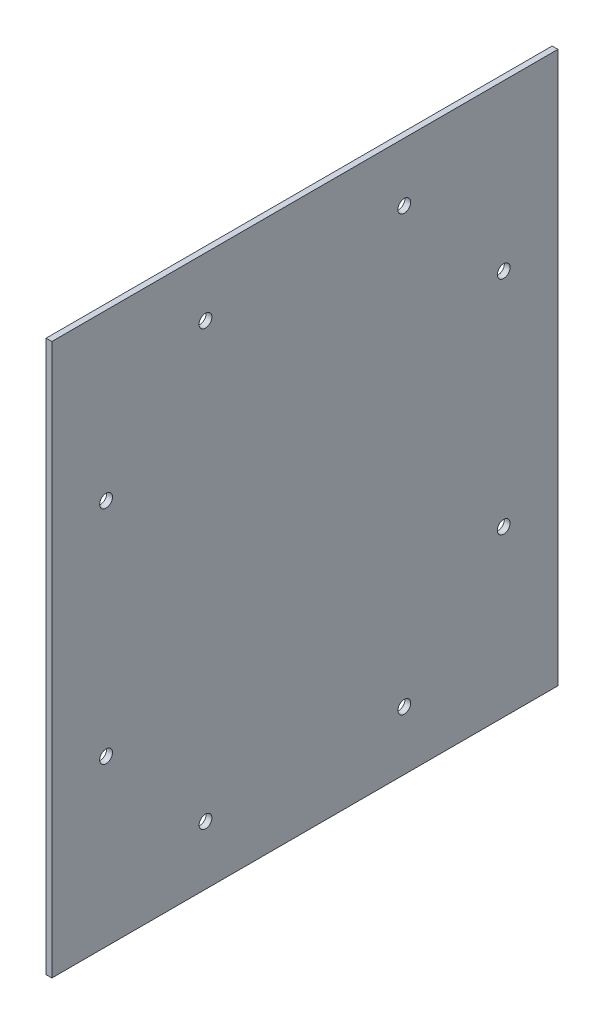
from build123d import *

# Parameters (mm, degrees)
SKETCH1_W            = 355.6
SKETCH1_H            = 387.35
BOSS_EXTRUDE1_DEPTH  = 4.064
M8_CLEARANCE_HOLE1_D = 9


with BuildPart() as part:
    # Sketch1 → Boss-Extrude1 (new body)
    with BuildSketch(Plane(origin=(0, 0, 0), x_dir=(0, 0, -1), z_dir=(1, 0, 0))):
        Rectangle(SKETCH1_W, SKETCH1_H)
    extrude(amount=BOSS_EXTRUDE1_DEPTH)

    # M8 Clearance Hole1 (through all)
    with Locations(Plane(origin=(4.064, 0, 0), x_dir=(0, 0, -1), z_dir=(1, 0, 0))):
        with Locations((-139.7, 77.7875), (-69.85, 152.4), (69.85, 152.4), (139.7, 77.7875), (139.7, -77.7875), (69.85, -152.4), (-69.85, -152.4), (-139.7, -77.7875)):
            Hole(M8_CLEARANCE_HOLE1_D / 2)


solid = part.part
